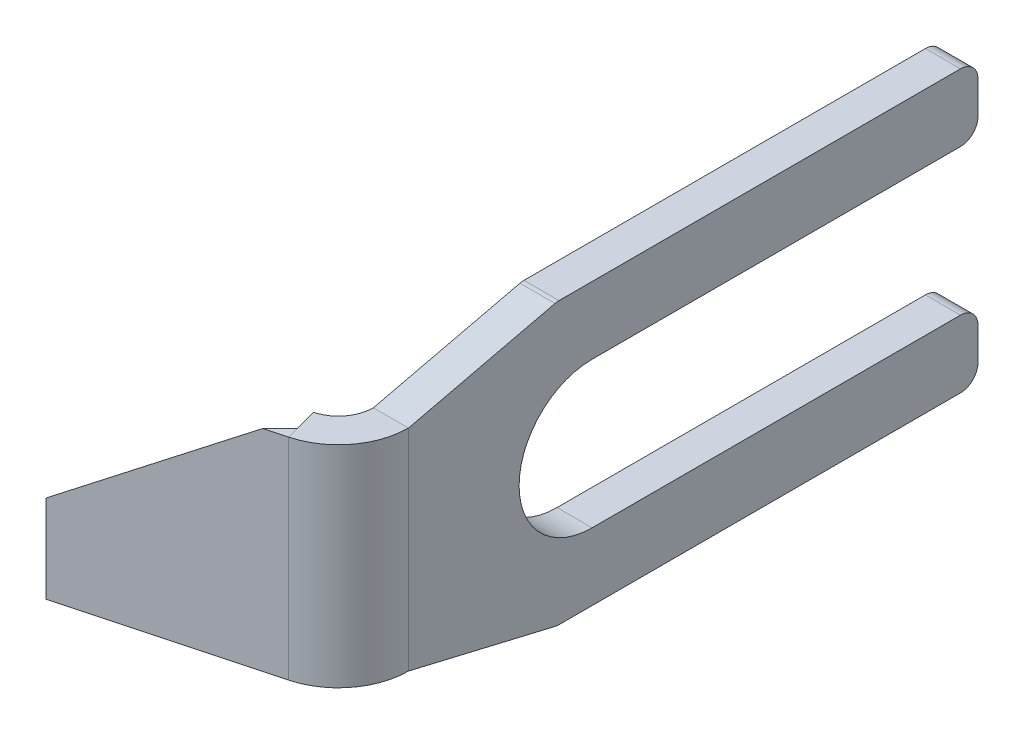
from build123d import *

# Parameters (mm, degrees)
BASE_FLANGE1_DEPTH  = 4.7625
CUT_EXTRUDE2_DEPTH  = 33.017769542
CUT_EXTRUDE3_REACH  = 35.526
TAB1_DEPTH          = 1.5875
BREAK_CORNER1_DEPTH = 1.5875
CUT_EXTRUDE7_REACH  = 32.474
SKETCH10_W          = 10.847778963
SKETCH10_H          = 1.122532015
CUT_EXTRUDE8_DEPTH  = 7.9375
CUT_EXTRUDE9_REACH  = 32.812
CUT_EXTRUDE4_DEPTH  = 35.511511322


# Read off the part's stored shape, not the designer's step: Break-Corner1
# Sheet-metal steps are written as plain solids
with BuildPart() as part:
    # Sketch1 → Base-Flange1 (new, symmetric)
    with BuildSketch(Plane(origin=(0, 0, 0), x_dir=(1, 0, 0), z_dir=(0, 1, 0))):
        with BuildLine():
            Line((0, 0), (0, -25.769368407))
            ThreePointArc((0, -25.769368407), (-0.328051572, -26.735777175), (-1.176624766, -27.302775656))
            Line((-1.176624766, -27.302775656), (-9.838340911, -29.623675502))
            Line((-9.838340911, -29.623675502), (-9.427465677, -31.157082751))
            Line((-9.427465677, -31.157082751), (-0.765749532, -28.836182905))
            ThreePointArc((-0.765749532, -28.836182905), (0.931396855, -27.702185944), (1.5875, -25.769368407))
            Line((1.5875, -25.769368407), (1.5875, 0))
            Line((1.5875, 0), (0, 0))
        make_face()
    extrude(amount=BASE_FLANGE1_DEPTH, both=True)

    # Sketch4 → Cut-Extrude2 (cut, through all)
    with BuildSketch(Plane(origin=(7.157750234, 0, 26.713087542), x_dir=(0.9659258262890691, 0, -0.2588190451025182), z_dir=(0.2588190451025182, 0, 0.9659258262890691))):
        Polygon((-17.17027898, 4.7625), (-17.17027898, -0.79375), (-9.162982379, 4.7625), align=None)
    extrude(amount=-CUT_EXTRUDE2_DEPTH, mode=Mode.SUBTRACT)

    # Sketch5 → Cut-Extrude3 (cut, up to next)
    with BuildSketch(Plane(origin=(1.5875, 0, 0), x_dir=(0, 0, -1), z_dir=(1, 0, 0)), mode=Mode.PRIVATE) as cut_extrude3_sk1:
        with BuildLine():
            Line((0, -3.302), (-17.4625, -3.302))
            ThreePointArc((-17.4625, -3.302), (-20.7645, 0), (-17.4625, 3.302))
            Line((-17.4625, 3.302), (0, 3.302))
            ThreePointArc((0, 3.302), (3.302, 0), (0, -3.302))
        make_face()
    cut_extrude3_tool1 = extrude(cut_extrude3_sk1.sketch, amount=-CUT_EXTRUDE3_REACH, mode=Mode.PRIVATE) & part.part
    add(cut_extrude3_tool1.solids().sort_by_distance((1.5875, 0, 8.73125))[0], mode=Mode.SUBTRACT)

    # Sketch6 → Tab1 (add)
    with BuildSketch(Plane(origin=(1.5875, 0, 0), x_dir=(0, 0, -1), z_dir=(1, 0, 0))):
        Polygon((-25.769368407, 4.7625), (0, 4.7625), (0, 6.35), (-19.05, 6.35), align=None)
        Polygon((0, -4.7625), (-25.769368407, -4.7625), (-19.05, -6.35), (0, -6.35), align=None)
    extrude(amount=-TAB1_DEPTH)

    # Break-Corner1 outline → Break-Corner1 (cut)
    with BuildSketch(Plane.YZ):
        with BuildLine():
            ThreePointArc((-3.302, 0.79375), (-3.534483992, 0.232483992), (-4.09575, 0))
            Line((-4.09575, 0), (-3.302, 0))
            Line((-3.302, 0), (-3.302, 0.79375))
        make_face()
        with BuildLine():
            ThreePointArc((-5.55625, 0), (-6.117516008, 0.232483992), (-6.35, 0.79375))
            Line((-6.35, 0.79375), (-6.35, 0))
            Line((-6.35, 0), (-5.55625, 0))
        make_face()
        with BuildLine():
            ThreePointArc((-6.35, 18.957508511), (-6.344665491, 19.049378398), (-6.328733667, 19.140013435))
            Line((-6.328733667, 19.140013435), (-6.35, 19.05))
            Line((-6.35, 19.05), (-6.35, 18.957508511))
        make_face()
        with BuildLine():
            Line((3.302, 0), (4.09575, 0))
            ThreePointArc((4.09575, 0), (3.534483992, 0.232483992), (3.302, 0.79375))
            Line((3.302, 0.79375), (3.302, 0))
        make_face()
        with BuildLine():
            Line((6.35, 0), (6.35, 0.79375))
            ThreePointArc((6.35, 0.79375), (6.117516008, 0.232483992), (5.55625, 0))
            Line((5.55625, 0), (6.35, 0))
        make_face()
        with BuildLine():
            ThreePointArc((6.328733667, 19.140013435), (6.344665491, 19.049378398), (6.35, 18.957508511))
            Line((6.35, 18.957508511), (6.35, 19.05))
            Line((6.35, 19.05), (6.328733667, 19.140013435))
        make_face()
    extrude(amount=BREAK_CORNER1_DEPTH, mode=Mode.SUBTRACT)

    # Cut-Extrude7: up to this plane
    cut_extrude7_end = Plane(origin=(0, 4.7625, 26.9875), z_dir=(0.25881904510251813, 0, 0.965925826289069))
    # Sketch10 → Cut-Extrude7 (cut, up to the surface)
    with BuildSketch(Plane(origin=(-5.368839639, 15.113767658, 20.483491715), x_dir=(0.7935854418944778, 0.5700930896630726, -0.21264057828071875), z_dir=(-0.20636811960864032, 0.5809448636137555, 0.7873469785615419)), mode=Mode.PRIVATE) as cut_extrude7_sk1:
        with Locations((-10.236945168, -12.533570263)):
            Rectangle(SKETCH10_W, SKETCH10_H)
    cut_extrude7_tool1 = split(extrude(cut_extrude7_sk1.sketch, amount=-CUT_EXTRUDE7_REACH, mode=Mode.PRIVATE), bisect_by=cut_extrude7_end, keep=Keep.BOTH, mode=Mode.PRIVATE)
    add(cut_extrude7_tool1.solids().sort_by_distance((-6.318596, 1.996443, 29.913188))[0], mode=Mode.SUBTRACT)

    # Sketch11 → Cut-Extrude8 (cut)
    with BuildSketch(Plane(origin=(7.495399471, -7.607377871, 7.577699232), x_dir=(0.819979057279916, 0.40553362238795987, -0.4039515153273222), z_dir=(-0.5723935233930764, 0.5809448636137574, -0.5786784252228975))):
        Polygon((-10.640638737, -21.79431173), (-10.575909421, -21.81114428), (-10.249235129, -23.422955447), (-10.344964483, -23.791081213), (-11.205664927, -23.967111285), align=None)
    extrude(amount=CUT_EXTRUDE8_DEPTH, mode=Mode.SUBTRACT)

    # Cut-Extrude9: up to this face of the body (flat: up to its plane)
    cut_extrude9_end = Plane(part.part.faces().sort_by_distance((-5.381060773, 1.282704756, 29.23921233))[0])
    # Sketch12 → Cut-Extrude9 (cut, up to the picked face)
    with BuildSketch(Plane(origin=(6.746875, 0, 25.179680292), x_dir=(-0.9659258262890691, 0, 0.25881904510251813), z_dir=(-0.25881904510251813, 0, -0.9659258262890691)), mode=Mode.PRIVATE) as cut_extrude9_sk1:
        Polygon((8.558950337, 4.7625), (8.203010573, 3.496370622), (8.203010573, 4.7625), align=None)
    cut_extrude9_tool1 = split(extrude(cut_extrude9_sk1.sketch, amount=-CUT_EXTRUDE9_REACH, mode=Mode.PRIVATE), bisect_by=cut_extrude9_end, keep=Keep.BOTH, mode=Mode.PRIVATE)
    add(cut_extrude9_tool1.solids().sort_by(Axis((-1.291229, 4.340457, 27.333484), (0.25881904510251813, 0, 0.9659258262890691)))[0], mode=Mode.SUBTRACT)

    # Sketch7 → Cut-Extrude4 (cut, through all)
    with BuildSketch(Plane.XZ.offset(4.7625)):
        Polygon((-9.427465677, 31.157082751), (-8.304933662, 29.212800268), (-9.838340911, 29.623675502), align=None)
    extrude(amount=-CUT_EXTRUDE4_DEPTH, mode=Mode.SUBTRACT)


solid = part.part
